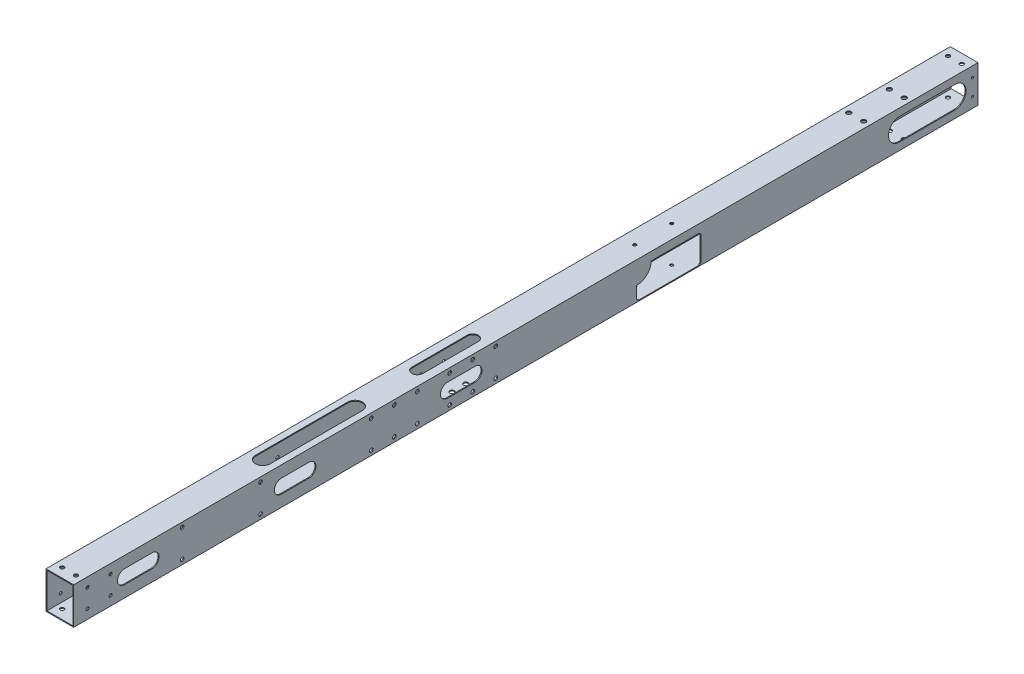
from build123d import *

# Parameters (mm, degrees)
SKETCH_1_W             = 30
SKETCH_1_H             = 40
SKETCH_1_W_2           = 28
SKETCH_1_H_2           = 38
EXTRUDE_1_DEPTH        = 940
SKETCH_5_R             = 2.5
CUT_EXTRUDE_3_DEPTH    = 941.97024395
CUT_EXTRUDE_4_DEPTH    = 1
SKETCH_7_R             = 1.75
CUT_EXTRUDE_5_DEPTH    = 1
SKETCH_17_W            = 30
SKETCH_17_H            = 40
SKETCH_17_W_2          = 28
SKETCH_17_H_2          = 38
EXTRUDE_2_DEPTH        = 20
SKETCH_18_W            = 30
SKETCH_18_H            = 40
SKETCH_18_W_2          = 28
SKETCH_18_H_2          = 38
EXTRUDE_3_DEPTH        = 20
SKETCH_19_R            = 2.1
CUT_EXTRUDE_16_DEPTH   = 961.950050731
SKETCH_20_R            = 1.6
CUT_EXTRUDE_17_DEPTH   = 961.67684473
SKETCH_23_R            = 2.5
CUT_EXTRUDE_19_DEPTH   = 961.950050731
SKETCH_24_R            = 4.5
CUT_EXTRUDE_20_DEPTH   = 10
SKETCH_26_R            = 2
CUT_EXTRUDE_22_DEPTH   = 961.67684473
CUT_EXTRUDE_28_DEPTH   = 10
PATTERN_LINEAR_4_COUNT = 2
PATTERN_LINEAR_4_PITCH = 255
PATTERN_LINEAR_8_COUNT = 2
PATTERN_LINEAR_8_PITCH = 205
PATTERN_LINEAR_9_COUNT = 2
PATTERN_LINEAR_9_PITCH = 230
CUT_EXTRUDE_START      = -20
SKETCH_34_R            = 1.75
CUT_EXTRUDE_29_DEPTH   = 20
SKETCH_35_R            = 1.5
CUT_EXTRUDE_30_DEPTH   = 10
CUT_EXTRUDE_31_DEPTH   = 10
SKETCH_37_R            = 1.65
CUT_EXTRUDE_32_DEPTH   = 52
SKETCH_39_R            = 1.75
CUT_EXTRUDE_33_DEPTH   = 10
SKETCH_40_W            = 70
SKETCH_40_H            = 30
CUT_EXTRUDE_34_DEPTH   = 10
EXTRUDE_5_DEPTH        = 1
SKETCH_43_W            = 38.522995696
SKETCH_43_H            = 13.00002022
EXTRUDE_6_DEPTH        = 1
FILLET_1_R             = 3
CUT_EXTRUDE_35_DEPTH   = 10
SKETCH_45_R            = 1.1
CUT_EXTRUDE_36_DEPTH   = 71
CUT_EXTRUDE_37_DEPTH   = 10
FILLET_2_R             = 15


with BuildPart() as part:
    # 草图1 → 凸台-拉伸1 (new body)
    with BuildSketch(Plane.XY):
        Rectangle(SKETCH_1_W, SKETCH_1_H)
        Rectangle(SKETCH_1_W_2, SKETCH_1_H_2, mode=Mode.SUBTRACT)
    extrude(amount=EXTRUDE_1_DEPTH)

    # 草图5 → 切除-拉伸3 (cut, through all)
    with BuildSketch(Plane.XZ.offset(20)):
        with Locations(Location((-8, 53, 0), (0, 0, 270))):
            Circle(SKETCH_5_R)
        with Locations(Location((8, 53, 0), (0, 0, 270))):
            Circle(SKETCH_5_R)
        with Locations(Location((-8, 97, 0), (0, 0, 270))):
            Circle(SKETCH_5_R)
        with Locations(Location((8, 97, 0), (0, 0, 270))):
            Circle(SKETCH_5_R)
    extrude(amount=-CUT_EXTRUDE_3_DEPTH, mode=Mode.SUBTRACT)

    # 草图6 → 切除-拉伸4 (cut)
    with BuildSketch(Plane(origin=(15, 0, 0), x_dir=(0, 0, -1), z_dir=(1, 0, 0))):
        with BuildLine():
            Line((-345, -7.5), (-375, -7.5))
            ThreePointArc((-375, -7.5), (-382.5, 0), (-375, 7.5))
            Line((-375, 7.5), (-345, 7.5))
            ThreePointArc((-345, 7.5), (-337.5, 0), (-345, -7.5))
        make_face()
        with BuildLine():
            Line((-525, -7.5), (-555, -7.5))
            ThreePointArc((-555, -7.5), (-562.5, 0), (-555, 7.5))
            Line((-555, 7.5), (-525, 7.5))
            ThreePointArc((-525, 7.5), (-517.5, 0), (-525, -7.5))
        make_face()
        with BuildLine():
            Line((-705, -7.5), (-735, -7.5))
            ThreePointArc((-735, -7.5), (-742.5, 0), (-735, 7.5))
            Line((-735, 7.5), (-705, 7.5))
            ThreePointArc((-705, 7.5), (-697.5, 0), (-705, -7.5))
        make_face()
    extrude(amount=-CUT_EXTRUDE_4_DEPTH, mode=Mode.SUBTRACT)

    # 草图7 → 切除-拉伸5 (cut)
    with BuildSketch(Plane.ZY.offset(15)):
        with Locations((350, 0)):
            Circle(SKETCH_7_R)
        with Locations((375, 0)):
            Circle(SKETCH_7_R)
        with Locations((530, 0)):
            Circle(SKETCH_7_R)
        with Locations((555, 0)):
            Circle(SKETCH_7_R)
        with Locations((710, 0)):
            Circle(SKETCH_7_R)
        with Locations((735, 0)):
            Circle(SKETCH_7_R)
    extrude(amount=-CUT_EXTRUDE_5_DEPTH, mode=Mode.SUBTRACT)

    # 草图17 → 凸台-拉伸2 (add)
    with BuildSketch(Plane.XY.offset(940)):
        Rectangle(SKETCH_17_W, SKETCH_17_H)
        Rectangle(SKETCH_17_W_2, SKETCH_17_H_2, mode=Mode.SUBTRACT)
    extrude(amount=EXTRUDE_2_DEPTH)

    # 草图18 → 凸台-拉伸3 (add)
    with BuildSketch(Plane(origin=(0, 0, 0), x_dir=(-1, 0, 0), z_dir=(0, 0, -1))):
        Rectangle(SKETCH_18_W, SKETCH_18_H)
        Rectangle(SKETCH_18_W_2, SKETCH_18_H_2, mode=Mode.SUBTRACT)
    extrude(amount=EXTRUDE_3_DEPTH)

    # 草图19 → 切除-拉伸16 (cut, through all)
    with BuildSketch(Plane(origin=(0, 20, 0), x_dir=(1, 0, 0), z_dir=(0, 1, 0))):
        with Locations(Location((-7.5, -950, 0), (0, 0, 270))):
            Circle(SKETCH_19_R)
        with Locations(Location((7.5, -950, 0), (0, 0, 270))):
            Circle(SKETCH_19_R)
        with Locations(Location((-7.5, 10, 0), (0, 0, 270))):
            Circle(SKETCH_19_R)
        with Locations(Location((7.5, 10, 0), (0, 0, 270))):
            Circle(SKETCH_19_R)
    extrude(amount=-CUT_EXTRUDE_16_DEPTH, mode=Mode.SUBTRACT)

    # 草图20 → 切除-拉伸17 (cut, through all)
    with BuildSketch(Plane(origin=(15, 0, 0), x_dir=(0, 0, -1), z_dir=(1, 0, 0))):
        with Locations((-945, 10)):
            Circle(SKETCH_20_R)
        with Locations((-920, 10)):
            Circle(SKETCH_20_R)
        with Locations((-920, -10)):
            Circle(SKETCH_20_R)
        with Locations((-945, -10)):
            Circle(SKETCH_20_R)
    extrude(amount=-CUT_EXTRUDE_17_DEPTH, mode=Mode.SUBTRACT)

    # 草图23 → 切除-拉伸19 (cut, through all)
    with BuildSketch(Plane(origin=(0, 20, 0), x_dir=(1, 0, 0), z_dir=(0, 1, 0))):
        with Locations(Location((0, -520, 0), (0, 0, 270))):
            Circle(SKETCH_23_R)
        with Locations(Location((0, -535, 0), (0, 0, 270))):
            Circle(SKETCH_23_R)
        with Locations(Location((0, -550, 0), (0, 0, 270))):
            Circle(SKETCH_23_R)
        with Locations(Location((0, -565, 0), (0, 0, 270))):
            Circle(SKETCH_23_R)
    extrude(amount=-CUT_EXTRUDE_19_DEPTH, mode=Mode.SUBTRACT)

    # 草图24 → 切除-拉伸20 (cut)
    with BuildSketch(Plane(origin=(0, 20, 0), x_dir=(1, 0, 0), z_dir=(0, 1, 0))):
        with Locations(Location((0, -520, 0), (0, 0, 270))):
            Circle(SKETCH_24_R)
        with Locations(Location((0, -535, 0), (0, 0, 270))):
            Circle(SKETCH_24_R)
        with Locations(Location((0, -550, 0), (0, 0, 270))):
            Circle(SKETCH_24_R)
        with Locations(Location((0, -565, 0), (0, 0, 270))):
            Circle(SKETCH_24_R)
    extrude(amount=-CUT_EXTRUDE_20_DEPTH, mode=Mode.SUBTRACT)

    # 草图26 → 切除-拉伸22 (cut, through all)
    with BuildSketch(Plane(origin=(15, 0, 0), x_dir=(0, 0, -1), z_dir=(1, 0, 0))):
        with Locations((-842.5, 15)):
            Circle(SKETCH_26_R)
        with Locations((-842.5, -15)):
            Circle(SKETCH_26_R)
        with Locations((-757.5, -15)):
            Circle(SKETCH_26_R)
        with Locations((-757.5, 15)):
            Circle(SKETCH_26_R)
    cut_extrude_22 = extrude(amount=-CUT_EXTRUDE_22_DEPTH, mode=Mode.SUBTRACT)

    # 草图33 → 切除-拉伸28 (cut)
    with BuildSketch(Plane(origin=(0, 20, 0), x_dir=(1, 0, 0), z_dir=(0, 1, 0))):
        with BuildLine():
            Line((6, -512.5), (6, -572.5))
            ThreePointArc((6, -572.5), (0, -578.5), (-6, -572.5))
            Line((-6, -572.5), (-6, -512.5))
            ThreePointArc((-6, -512.5), (0, -506.5), (6, -512.5))
        make_face()
    extrude(amount=-CUT_EXTRUDE_28_DEPTH, mode=Mode.SUBTRACT)

    # 阵列(线性)4: 切除-拉伸22 ×2
    with Locations(*[(0, 0, -i * PATTERN_LINEAR_4_PITCH) for i in range(1, PATTERN_LINEAR_4_COUNT)]):
        add(cut_extrude_22, mode=Mode.SUBTRACT)

    # 阵列(线性)8: 切除-拉伸22 ×2
    with Locations(*[(0, 0, -i * PATTERN_LINEAR_8_PITCH) for i in range(1, PATTERN_LINEAR_8_COUNT)]):
        add(cut_extrude_22, mode=Mode.SUBTRACT)

    # 阵列(线性)9: 切除-拉伸22 ×2
    with Locations(*[(0, 0, -i * PATTERN_LINEAR_9_PITCH) for i in range(1, PATTERN_LINEAR_9_COUNT)]):
        add(cut_extrude_22, mode=Mode.SUBTRACT)

    # 草图34 → 切除-拉伸29 (cut)
    with BuildSketch(Plane(origin=(15, 0, 0), x_dir=(0, 0, -1), z_dir=(1, 0, 0)).offset(CUT_EXTRUDE_START)):
        with Locations((-905, 0)):
            Circle(SKETCH_34_R)
        with Locations((-880, 0)):
            Circle(SKETCH_34_R)
    extrude(amount=-CUT_EXTRUDE_29_DEPTH, mode=Mode.SUBTRACT)

    # 草图35 → 切除-拉伸30 (cut)
    with BuildSketch(Plane.XZ.offset(20)):
        with Locations(Location((5, 720, 0), (0, 0, 270))):
            Circle(SKETCH_35_R)
        with Locations(Location((5, 700, 0), (0, 0, 270))):
            Circle(SKETCH_35_R)
        with Locations(Location((5, 680, 0), (0, 0, 270))):
            Circle(SKETCH_35_R)
        with Locations(Location((5, 660, 0), (0, 0, 270))):
            Circle(SKETCH_35_R)
        with Locations(Location((5, 640, 0), (0, 0, 270))):
            Circle(SKETCH_35_R)
        with Locations(Location((5, 740, 0), (0, 0, 270))):
            Circle(SKETCH_35_R)
    extrude(amount=-CUT_EXTRUDE_30_DEPTH, mode=Mode.SUBTRACT)

    # 草图36 → 切除-拉伸31 (cut)
    with BuildSketch(Plane(origin=(0, 20, 0), x_dir=(1, 0, 0), z_dir=(0, 1, 0))):
        with BuildLine():
            Line((8, -640), (8, -740))
            ThreePointArc((8, -740), (0, -748), (-8, -740))
            Line((-8, -740), (-8, -640))
            ThreePointArc((-8, -640), (0, -632), (8, -640))
        make_face()
    extrude(amount=-CUT_EXTRUDE_31_DEPTH, mode=Mode.SUBTRACT)

    # 草图37 → 切除-拉伸32 (cut)
    with BuildSketch(Plane(origin=(0, 20, 0), x_dir=(1, 0, 0), z_dir=(0, 1, 0))):
        with Locations(Location((0, -297, 0), (0, 0, 270))):
            Circle(SKETCH_37_R)
        with Locations(Location((0, -337, 0), (0, 0, 270))):
            Circle(SKETCH_37_R)
    extrude(amount=-CUT_EXTRUDE_32_DEPTH, mode=Mode.SUBTRACT)

    # 草图39 → 切除-拉伸33 (cut)
    with BuildSketch(Plane.XZ.offset(20)):
        with Locations(Location((0, 137, 0), (0, 0, 270))):
            Circle(SKETCH_39_R)
        with Locations(Location((0, 177, 0), (0, 0, 270))):
            Circle(SKETCH_39_R)
    extrude(amount=-CUT_EXTRUDE_33_DEPTH, mode=Mode.SUBTRACT)

    # 草图40 → 切除-拉伸34 (cut)
    with BuildSketch(Plane(origin=(15, 0, 0), x_dir=(0, 0, -1), z_dir=(1, 0, 0))):
        with Locations((-315, -4)):
            Rectangle(SKETCH_40_W, SKETCH_40_H)
    extrude(amount=-CUT_EXTRUDE_34_DEPTH, mode=Mode.SUBTRACT)

    # 草图42 → 凸台-拉伸5 (add)
    with BuildSketch(Plane(origin=(15, 0, 0), x_dir=(0, 0, -1), z_dir=(1, 0, 0))):
        Polygon((-350, -8.24794841), (-350, -4), (-334.23295051, -4), (-334.23295051, 12.222841732), (-383.610977641, 12.222841732), (-383.610977641, -8.24794841), align=None)
    extrude(amount=-EXTRUDE_5_DEPTH)

    # 草图43 → 凸台-拉伸6 (add)
    with BuildSketch(Plane.ZY.offset(15)):
        with Locations((362.400416305, 1.435266839)):
            Rectangle(SKETCH_43_W, SKETCH_43_H)
    extrude(amount=-EXTRUDE_6_DEPTH)

    # 圆角1
    fillet_1_edges = [part.edges().sort_by_distance(p)[0] for p in [
        (14.5, -19, 350),
        (14.5, 11, 280),
        (14.5, -19, 280),
    ]]
    fillet(fillet_1_edges, radius=FILLET_1_R)

    # 草图44 → 切除-拉伸35 (cut)
    with BuildSketch(Plane(origin=(15, 0, 0), x_dir=(0, 0, -1), z_dir=(1, 0, 0))):
        with BuildLine():
            Line((-875, 7.5), (-905, 7.5))
            ThreePointArc((-905, 7.5), (-912.5, 0), (-905, -7.5))
            Line((-905, -7.5), (-875, -7.5))
            ThreePointArc((-875, -7.5), (-867.5, 0), (-875, 7.5))
        make_face()
    extrude(amount=-CUT_EXTRUDE_35_DEPTH, mode=Mode.SUBTRACT)

    # 草图45 → 切除-拉伸36 (cut)
    with BuildSketch(Plane(origin=(15, 0, 0), x_dir=(0, 0, -1), z_dir=(1, 0, 0))):
        with Locations((-31.199995376, 9.020444537)):
            Circle(SKETCH_45_R)
        with Locations((14, 9)):
            Circle(SKETCH_45_R)
        with Locations((14, -9)):
            Circle(SKETCH_45_R)
        with Locations((-31.199995376, -9.020444537)):
            Circle(SKETCH_45_R)
    extrude(amount=-CUT_EXTRUDE_36_DEPTH, mode=Mode.SUBTRACT)

    # 草图46 → 切除-拉伸37 (cut)
    with BuildSketch(Plane(origin=(15, 0, 0), x_dir=(0, 0, -1), z_dir=(1, 0, 0))):
        with BuildLine():
            Line((-65, 12), (-5, 12))
            ThreePointArc((-5, 12), (7, 0), (-5, -12))
            Line((-5, -12), (-65, -12))
            ThreePointArc((-65, -12), (-77, 0), (-65, 12))
        make_face()
    extrude(amount=-CUT_EXTRUDE_37_DEPTH, mode=Mode.SUBTRACT)

    # 圆角2
    fillet_2_edges = [part.edges().sort_by_distance(p)[0] for p in [
        (14.5, -4, 334.23295051),
    ]]
    fillet(fillet_2_edges, radius=FILLET_2_R - 0.0001)  # a hair under: the kernel refuses the full size


solid = part.part
